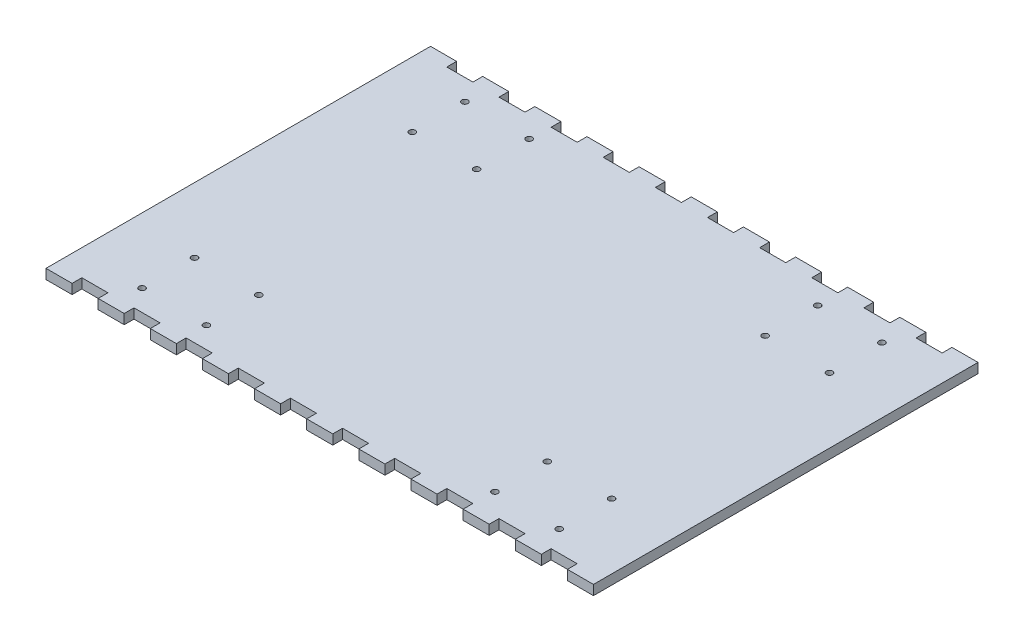
from build123d import *

# Parameters (mm, degrees)
BOSS_EXTRUDE1_DEPTH = 4.7625
SKETCH5_R           = 1.5
CUT_EXTRUDE1_DEPTH  = 283.708746438


with BuildPart() as part:
    # Sketch2 → Boss-Extrude1 (new body)
    with BuildSketch(Plane(origin=(0, 0, 0), x_dir=(1, 0, 0), z_dir=(0, 1, 0))):
        Polygon((25.4, 93.6625), (25.4, 88.9), (12.7, 88.9), (12.7, 93.6625), (0, 93.6625), (0, -93.6625), (12.7, -93.6625), (12.7, -88.9), (25.4, -88.9), (25.4, -93.6625), (38.1, -93.6625), (38.1, -88.9), (50.8, -88.9), (50.8, -93.6625), (63.5, -93.6625), (63.5, -88.9), (76.2, -88.9), (76.2, -93.6625), (88.9, -93.6625), (88.9, -88.9), (101.6, -88.9), (101.6, -93.6625), (114.3, -93.6625), (114.3, -88.9), (127, -88.9), (127, -93.6625), (139.7, -93.6625), (139.7, -88.9), (152.4, -88.9), (152.4, -93.6625), (165.1, -93.6625), (165.1, -88.9), (177.8, -88.9), (177.8, -93.6625), (190.5, -93.6625), (190.5, -88.9), (203.2, -88.9), (203.2, -93.6625), (215.9, -93.6625), (215.9, -88.9), (228.6, -88.9), (228.6, -93.6625), (241.3, -93.6625), (241.3, -88.9), (254, -88.9), (254, -93.6625), (266.7, -93.6625), (266.7, 93.6625), (254, 93.6625), (254, 88.9), (241.3, 88.9), (241.3, 93.6625), (228.6, 93.6625), (228.6, 88.9), (215.9, 88.9), (215.9, 93.6625), (203.2, 93.6625), (203.2, 88.9), (190.5, 88.9), (190.5, 93.6625), (177.8, 93.6625), (177.8, 88.9), (165.1, 88.9), (165.1, 93.6625), (152.4, 93.6625), (152.4, 88.9), (139.7, 88.9), (139.7, 93.6625), (127, 93.6625), (127, 88.9), (114.3, 88.9), (114.3, 93.6625), (101.6, 93.6625), (101.6, 88.9), (88.9, 88.9), (88.9, 93.6625), (76.2, 93.6625), (76.2, 88.9), (63.5, 88.9), (63.5, 93.6625), (50.8, 93.6625), (50.8, 88.9), (38.1, 88.9), (38.1, 93.6625), align=None)
    extrude(amount=BOSS_EXTRUDE1_DEPTH)

    # Sketch5 → Cut-Extrude1 (cut, through all)
    with BuildSketch(Plane(origin=(0, 4.7625, 0), x_dir=(1, 0, 0), z_dir=(0, 1, 0))):
        with Locations((31.75, 78.6125)):
            Circle(SKETCH5_R)
        with Locations((63.07, 78.6125)):
            Circle(SKETCH5_R)
        with Locations((63.07, 53.0625)):
            Circle(SKETCH5_R)
        with Locations((31.75, 53.0625)):
            Circle(SKETCH5_R)
        with Locations((203.63, 78.6125)):
            Circle(SKETCH5_R)
        with Locations((203.63, 53.0625)):
            Circle(SKETCH5_R)
        with Locations((234.95, 53.0625)):
            Circle(SKETCH5_R)
        with Locations((234.95, 78.6125)):
            Circle(SKETCH5_R)
        with Locations((234.95, -78.6125)):
            Circle(SKETCH5_R)
        with Locations((234.95, -53.0625)):
            Circle(SKETCH5_R)
        with Locations((203.63, -53.0625)):
            Circle(SKETCH5_R)
        with Locations((203.63, -78.6125)):
            Circle(SKETCH5_R)
        with Locations((31.75, -53.0625)):
            Circle(SKETCH5_R)
        with Locations((63.07, -53.0625)):
            Circle(SKETCH5_R)
        with Locations((63.07, -78.6125)):
            Circle(SKETCH5_R)
        with Locations((31.75, -78.6125)):
            Circle(SKETCH5_R)
    extrude(amount=-CUT_EXTRUDE1_DEPTH, mode=Mode.SUBTRACT)


solid = part.part
